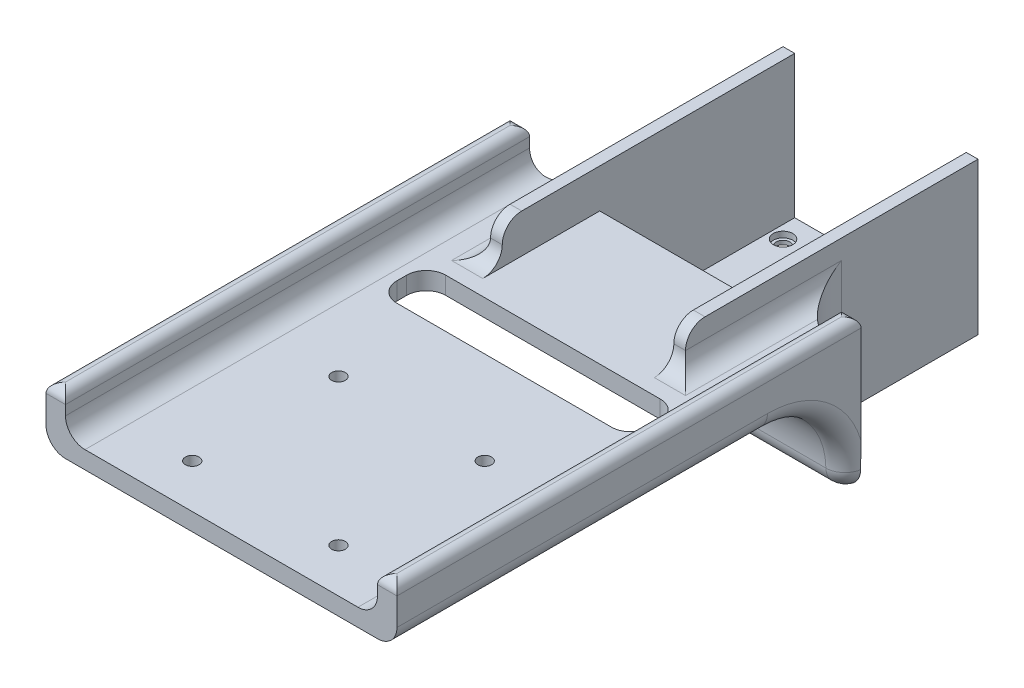
from build123d import *

# Parameters (mm, degrees)
SKETCH1_W           = 100
SKETCH1_H           = 100
SKETCH1_R           = 3.5
BOSS_EXTRUDE1_DEPTH = 5
CUT_EXTRUDE1_START  = -5
SKETCH6_R           = 5
CUT_EXTRUDE1_DEPTH  = 3
BOSS_EXTRUDE2_START = 40
SKETCH8_W           = 8
SKETCH8_H           = 58
BOSS_EXTRUDE2_DEPTH = 180
SKETCH9_W           = 180
SKETCH9_H           = 9
BOSS_EXTRUDE3_DEPTH = 230
SKETCH13_R          = 3.5
CUT_EXTRUDE3_DEPTH  = 9
SKETCH15_W          = 6
SKETCH15_H          = 100
BOSS_EXTRUDE6_DEPTH = 73
CUT_EXTRUDE4_REACH  = 309.259
SKETCH16_W          = 130
SKETCH16_H          = 25
FILLET1_R           = 40
FILLET2_R           = 10
SKETCH17_W          = 6
SKETCH17_H          = 20
BOSS_EXTRUDE7_DEPTH = 50
FILLET3_R           = 10
FILLET4_R           = 10
FILLET6_R           = 30
FILLET7_R           = 10
SKETCH18_W          = 10
SKETCH18_H          = 238
BOSS_EXTRUDE8_DEPTH = 20
FILLET8_R           = 10
FILLET9_R           = 10
FILLET10_R          = 5


# Some blends are built 0.0001 mm under size
with BuildPart() as part:
    # Sketch1 → Boss-Extrude1 (new body)
    with BuildSketch(Plane(origin=(0, 0, 0), x_dir=(1, 0, 0), z_dir=(0, 1, 0))):
        Rectangle(SKETCH1_W, SKETCH1_H)
        with Locations(Location((-37.5, 37.5, 0), (0, 0, 270))):
            Circle(SKETCH1_R, mode=Mode.SUBTRACT)
        with Locations(Location((37.5, 37.5, 0), (0, 0, 90))):
            Circle(SKETCH1_R, mode=Mode.SUBTRACT)
        with Locations(Location((37.5, -37.5, 0), (0, 0, 270))):
            Circle(SKETCH1_R, mode=Mode.SUBTRACT)
        with Locations(Location((-37.5, -37.5, 0), (0, 0, 90))):
            Circle(SKETCH1_R, mode=Mode.SUBTRACT)
    extrude(amount=BOSS_EXTRUDE1_DEPTH)

    # Sketch6 → Cut-Extrude1 (cut)
    with BuildSketch(Plane.XZ.offset(CUT_EXTRUDE1_START)):
        with Locations(Location((-37.5, 37.5, 0), (0, 0, 90))):
            Circle(SKETCH6_R)
        with Locations(Location((37.5, 37.5, 0), (0, 0, 90))):
            Circle(SKETCH6_R)
        with Locations(Location((37.5, -37.5, 0), (0, 0, 90))):
            Circle(SKETCH6_R)
        with Locations(Location((-37.5, -37.5, 0), (0, 0, 90))):
            Circle(SKETCH6_R)
    extrude(amount=CUT_EXTRUDE1_DEPTH, mode=Mode.SUBTRACT)

    # Sketch8 → Boss-Extrude2 (add)
    with BuildSketch(Plane.ZY.offset(50).offset(BOSS_EXTRUDE2_START)):
        with Locations((54, 29)):
            Rectangle(SKETCH8_W, SKETCH8_H)
    extrude(amount=-BOSS_EXTRUDE2_DEPTH)

    # Sketch9 → Boss-Extrude3 (add)
    with BuildSketch(Plane.XY.offset(58)):
        with Locations((0, 53.5)):
            Rectangle(SKETCH9_W, SKETCH9_H)
    extrude(amount=BOSS_EXTRUDE3_DEPTH)

    # Sketch13 → Cut-Extrude3 (cut)
    with BuildSketch(Plane(origin=(0, 58, 0), x_dir=(1, 0, 0), z_dir=(0, 1, 0))):
        with Locations(Location((-37.5, -190.5, 0), (0, 0, 270))):
            Circle(SKETCH13_R)
        with Locations(Location((37.5, -190.5, 0), (0, 0, 270))):
            Circle(SKETCH13_R)
        with Locations(Location((37.5, -265.5, 0), (0, 0, 270))):
            Circle(SKETCH13_R)
        with Locations(Location((-37.5, -265.5, 0), (0, 0, 270))):
            Circle(SKETCH13_R)
    extrude(amount=-CUT_EXTRUDE3_DEPTH, mode=Mode.SUBTRACT)

    # Sketch15 → Boss-Extrude6 (add)
    with BuildSketch(Plane(origin=(0, 5, 0), x_dir=(1, 0, 0), z_dir=(0, 1, 0))):
        with Locations((-47, 0)):
            Rectangle(SKETCH15_W, SKETCH15_H)
        with Locations((47, 0)):
            Rectangle(SKETCH15_W, SKETCH15_H)
    extrude(amount=BOSS_EXTRUDE6_DEPTH)

    # Sketch16 → Cut-Extrude4 (cut, up to next)
    with BuildSketch(Plane(origin=(0, 58, 0), x_dir=(1, 0, 0), z_dir=(0, 1, 0)), mode=Mode.PRIVATE) as cut_extrude4_sk1:
        with Locations((0, -130.5)):
            Rectangle(SKETCH16_W, SKETCH16_H)
    cut_extrude4_tool1 = extrude(cut_extrude4_sk1.sketch, amount=-CUT_EXTRUDE4_REACH, mode=Mode.PRIVATE) & part.part
    add(cut_extrude4_tool1.solids().sort_by_distance((0, 58, 130.5))[0], mode=Mode.SUBTRACT)

    # Fillet1
    fillet1_edges = [part.edges().sort_by_distance(p)[0] for p in [
        (0, 49, 58),
    ]]
    fillet(fillet1_edges, radius=FILLET1_R)

    # Fillet2
    fillet2_edges = [part.edges().sort_by_distance(p)[0] for p in [
        (65, 53.5, 118),
        (65, 53.5, 143),
        (-65, 53.5, 143),
        (-65, 53.5, 118),
    ]]
    fillet(fillet2_edges, radius=FILLET2_R)

    # Sketch17 → Boss-Extrude7 (add)
    with BuildSketch(Plane.XY.offset(50)):
        with Locations((-47, 68)):
            Rectangle(SKETCH17_W, SKETCH17_H)
        with Locations((47, 68)):
            Rectangle(SKETCH17_W, SKETCH17_H)
    extrude(amount=BOSS_EXTRUDE7_DEPTH)

    # Fillet3
    fillet3_edges = [part.edges().sort_by_distance(p)[0] for p in [
        (47, 78, 100),
        (-47, 78, 100),
    ]]
    fillet(fillet3_edges, radius=FILLET3_R)

    # Fillet4
    fillet4_edges = [part.edges().sort_by_distance(p)[0] for p in [
        (47, 58, 100),
        (-47, 58, 100),
    ]]
    fillet(fillet4_edges, radius=FILLET4_R - 0.0001)  # a hair under: the kernel refuses the full size

    # Fillet6
    fillet6_edges = [part.edges().sort_by_distance(p)[0] for p in [
        (50, 29, 50),
        (-50, 29, 50),
    ]]
    fillet(fillet6_edges, radius=FILLET6_R)

    # Fillet7
    # the kernel refuses this fillet: 10 mm, written as the material it takes off along each edge
    with BuildSketch(Plane(origin=(-114.974997499, 0, 58), x_dir=(0, 0.9999996667390088, 0.0008164079075175184), z_dir=(1, 0, 0))) as fillet7_piece_1:
        with BuildLine():
            CenterArc((9.991840753, -9.99815975), FILLET7_R, 91.099215266, 88.854008002)
            Line((-0.008155914, -9.989995671), (-1.008155581, -9.989179263))
            Line((-1.008155581, -9.989179263), (-0.999999667, 0.000816408))
            Line((-0.999999667, 0.000816408), (0.000816408, 0.999999667))
            ThreePointArc((0.000816408, 0.999999667), (9.000813409, 0.992651996), (9.780819517, 0.999815975))
            Line((9.780819517, 0.999815975), (9.800003266, 0))
        make_face()
    extrude(amount=229.949994999, mode=Mode.SUBTRACT)

    # Sketch18 → Boss-Extrude8 (add)
    with BuildSketch(Plane(origin=(0, 58, 0), x_dir=(1, 0, 0), z_dir=(0, 1, 0))):
        with Locations((-85, -169)):
            Rectangle(SKETCH18_W, SKETCH18_H)
        with Locations((85, -169)):
            Rectangle(SKETCH18_W, SKETCH18_H)
    extrude(amount=BOSS_EXTRUDE8_DEPTH)

    # Fillet8
    # the kernel refuses this fillet: 10 mm, written as the material it adds along each edge
    with BuildSketch(Plane(origin=(80, 58, 25), x_dir=(0, 1, 0), z_dir=(0, 0, 1))) as fillet8_piece_1_section:
        with BuildLine():
            CenterArc((FILLET8_R, FILLET8_R), FILLET8_R, 180, 90)
            Line((0, FILLET8_R), (0, 0))
            Line((0, 0), (FILLET8_R, 0))
        make_face()
    fillet8_piece_1 = extrude(amount=263, mode=Mode.PRIVATE)
    fillet8_piece_1 = fillet8_piece_1 - Plane(origin=(80, 58.60546515, 20), x_dir=(-1, 0, 0), z_dir=(0, -1, 0)) * Cylinder(30, 567, mode=Mode.PRIVATE)
    add(fillet8_piece_1)
    with BuildSketch(Plane(origin=(-80, 58, 25), x_dir=(0, 1, 0), z_dir=(0, 0, 1))) as fillet8_piece_2_section:
        with BuildLine():
            CenterArc((FILLET8_R, -FILLET8_R), FILLET8_R, 90, 90)
            Line((0, -FILLET8_R), (0, 0))
            Line((0, 0), (FILLET8_R, 0))
        make_face()
    fillet8_piece_2 = extrude(amount=263, mode=Mode.PRIVATE)
    fillet8_piece_2 = fillet8_piece_2 - Plane(origin=(-80, 58.605465201, 20), x_dir=(0, 0, 1), z_dir=(0, -1, 0)) * Cylinder(30, 567, mode=Mode.PRIVATE)
    add(fillet8_piece_2)
    # the kernel refuses this fillet: 10 mm, written as the material it takes off along each edge
    with BuildSketch(Plane(origin=(90, 49, 98), x_dir=(-1, 0, 0), z_dir=(0, 0, 1))) as fillet8_2_piece_1:
        with BuildLine():
            CenterArc((FILLET8_R, -FILLET8_R), FILLET8_R, 90, 90)
            Line((0, -FILLET8_R), (0, 0))
            Line((0, 0), (FILLET8_R, 0))
        make_face()
    extrude(amount=215, mode=Mode.SUBTRACT)
    with BuildSketch(Plane(origin=(90, 10, 48.010001), x_dir=(0, 0.6665779251845226, -0.7454353557866013), z_dir=(0, 0.7454353557866013, 0.6665779251845226))) as fillet8_2_piece_2:
        with BuildLine():
            CenterArc((10 - FILLET8_R, FILLET8_R), FILLET8_R, 270, 90)
            Line((10 - FILLET8_R, 0), (10, 0))
            Line((10, 0), (10, FILLET8_R))
        make_face()
    revolve(axis=Axis((90, 10, 48.010001), (-1, 0, 0)), revolution_arc=220.657501671, mode=Mode.SUBTRACT)
    with BuildSketch(Plane(origin=(-90, 10, 48.010001), x_dir=(0, 0.6665779251845226, -0.7454353557866013), z_dir=(0, 0.7454353557866013, 0.6665779251845226))) as fillet8_2_piece_3:
        with BuildLine():
            CenterArc((10 - FILLET8_R, -FILLET8_R), FILLET8_R, 0, 90)
            Line((10 - FILLET8_R, 0), (10, 0))
            Line((10, 0), (10, -FILLET8_R))
        make_face()
    revolve(axis=Axis((-90, 10, 48.010001), (-1, 0, 0)), revolution_arc=220.657501671, mode=Mode.SUBTRACT)
    with BuildSketch(Plane(origin=(-90, 49, 98), x_dir=(1, 0, 0), z_dir=(0, 0, 1))) as fillet8_2_piece_4:
        with BuildLine():
            CenterArc((FILLET8_R, FILLET8_R), FILLET8_R, 180, 90)
            Line((0, FILLET8_R), (0, 0))
            Line((0, 0), (FILLET8_R, 0))
        make_face()
    extrude(amount=215, mode=Mode.SUBTRACT)
    with BuildSketch(Plane(origin=(90, 9, 98), x_dir=(0, 0.019999999999999886, -0.999799979995999), z_dir=(0, -0.999799979995999, -0.019999999999999886))) as fillet8_2_piece_5:
        with BuildLine():
            CenterArc((40 + FILLET8_R, -FILLET8_R), FILLET8_R, 90, 90)
            Line((40 + FILLET8_R, 0), (40, 0))
            Line((40, 0), (40, -FILLET8_R))
        make_face()
    revolve(axis=Axis((90, 9, 98), (1, 0, 0)), revolution_arc=88.854008002, mode=Mode.SUBTRACT)
    with BuildSketch(Plane(origin=(-90, 9, 98), x_dir=(0, 0.019999999999999886, -0.999799979995999), z_dir=(0, -0.999799979995999, -0.019999999999999886))) as fillet8_2_piece_6:
        with BuildLine():
            CenterArc((40 + FILLET8_R, FILLET8_R), FILLET8_R, 180, 90)
            Line((40 + FILLET8_R, 0), (40, 0))
            Line((40, 0), (40, FILLET8_R))
        make_face()
    revolve(axis=Axis((-90, 9, 98), (1, 0, 0)), revolution_arc=88.854008002, mode=Mode.SUBTRACT)

    # Fillet9
    fillet9_edges = [part.edges().sort_by_distance(p)[0] for p in [
        (50, 58, 64.99995),
        (-50, 58, 64.99995),
    ]]
    fillet(fillet9_edges, radius=FILLET9_R)

    # Fillet10
    fillet10_edges = [part.edges().sort_by_distance(p)[0] for p in [
        (-90, 78, 169),
        (-85, 78, 288),
        (-80, 78, 169),
        (-85, 78, 50),
        (90, 78, 169),
        (85, 78, 50),
        (80, 78, 169),
        (85, 78, 288),
    ]]
    fillet(fillet10_edges, radius=FILLET10_R - 0.0001)  # a hair under: the kernel refuses the full size


solid = part.part
